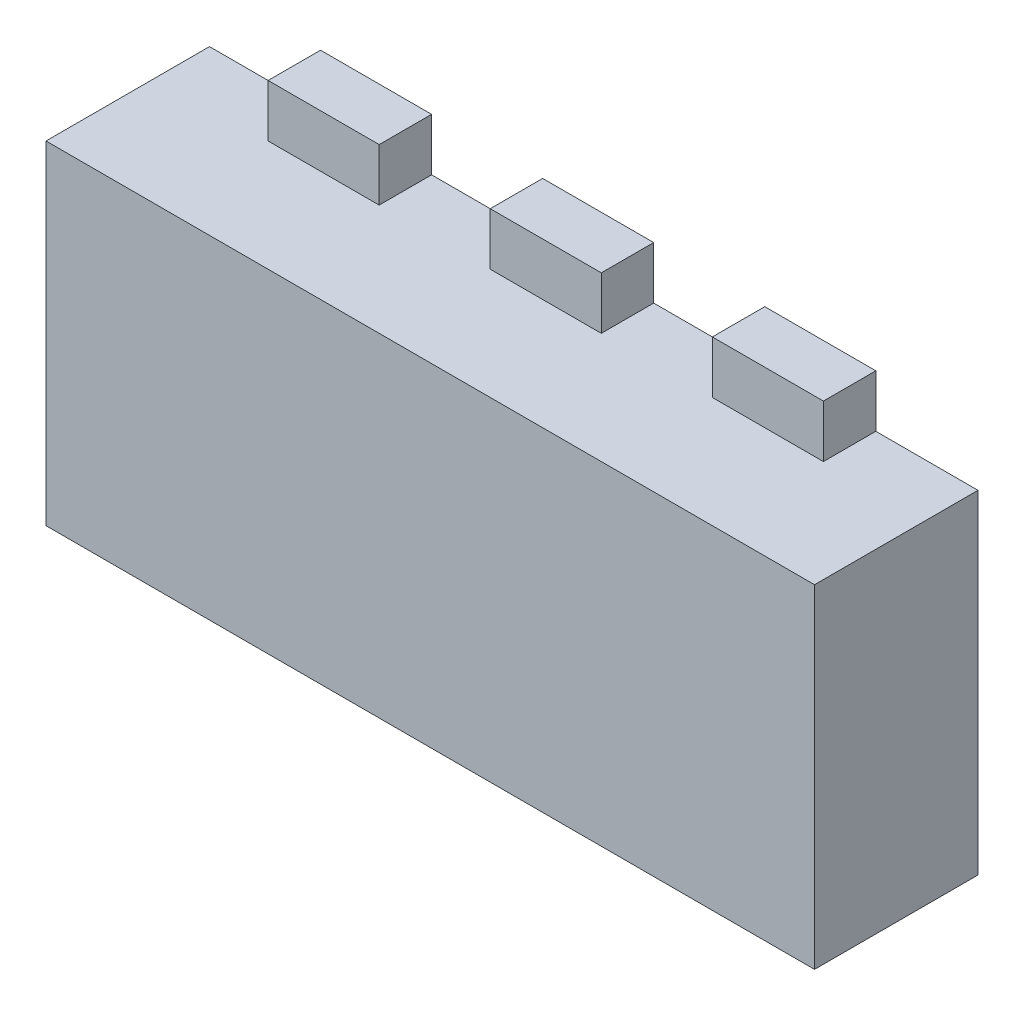
from build123d import *

# Parameters (mm, degrees)
SKETCH1_W               = 43.942
SKETCH1_H               = 19.05
BODY_DEPTH              = 2.9972
SKETCH2_W               = 6.35
SKETCH2_H               = 2.9972
TAB_DEPTH               = 2.9972
LPATTERN1_COUNT         = 3
LPATTERN1_PITCH         = 12.7
MIRROR1_COPY_1_SKETCH_W = 6.35
MIRROR1_COPY_1_SKETCH_H = 2.9972
MIRROR1_COPY_1_DEPTH    = 2.9972
MIRROR1_COPY_2_SKETCH_W = 6.35
MIRROR1_COPY_2_SKETCH_H = 2.9972
MIRROR1_COPY_2_DEPTH    = 2.9972
MIRROR1_COPY_3_SKETCH_W = 6.35
MIRROR1_COPY_3_SKETCH_H = 2.9972
MIRROR1_COPY_3_DEPTH    = 2.9972
SKETCH5_W               = 43.942
SKETCH5_H               = 19.05
BOSS_EXTRUDE1_DEPTH     = 6.35


with BuildPart() as part:
    # Sketch1 → Body (new body)
    with BuildSketch(Plane.XY):
        Rectangle(SKETCH1_W, SKETCH1_H)
    extrude(amount=BODY_DEPTH)

    # Sketch2 → Tab (add)
    with BuildSketch(Plane(origin=(0, 9.525, 0), x_dir=(1, 0, 0), z_dir=(0, 1, 0))):
        with Locations((-12.446, -1.4986)):
            Rectangle(SKETCH2_W, SKETCH2_H)
    tab = extrude(amount=TAB_DEPTH)

    # LPattern1: Tab ×3
    with Locations(*[(i * LPATTERN1_PITCH, 0, 0) for i in range(1, LPATTERN1_COUNT)]):
        add(tab)

    # Mirror1 copy 1 sketch → Mirror1 copy 1 (add)
    with BuildSketch(Plane(origin=(12.7, -9.525, 0), x_dir=(1, 0, 0), z_dir=(0, -1, 0))):
        with Locations((-12.446, 1.4986)):
            Rectangle(MIRROR1_COPY_1_SKETCH_W, MIRROR1_COPY_1_SKETCH_H)
    extrude(amount=MIRROR1_COPY_1_DEPTH)

    # Mirror1 copy 2 sketch → Mirror1 copy 2 (add)
    with BuildSketch(Plane(origin=(25.4, -9.525, 0), x_dir=(1, 0, 0), z_dir=(0, -1, 0))):
        with Locations((-12.446, 1.4986)):
            Rectangle(MIRROR1_COPY_2_SKETCH_W, MIRROR1_COPY_2_SKETCH_H)
    extrude(amount=MIRROR1_COPY_2_DEPTH)

    # Mirror1 copy 3 sketch → Mirror1 copy 3 (add)
    with BuildSketch(Plane.XZ.offset(9.525)):
        with Locations((-12.446, 1.4986)):
            Rectangle(MIRROR1_COPY_3_SKETCH_W, MIRROR1_COPY_3_SKETCH_H)
    extrude(amount=MIRROR1_COPY_3_DEPTH)

    # Sketch5 → Boss-Extrude1 (add)
    with BuildSketch(Plane.XY.offset(2.9972)):
        Rectangle(SKETCH5_W, SKETCH5_H)
    extrude(amount=BOSS_EXTRUDE1_DEPTH)


solid = part.part
